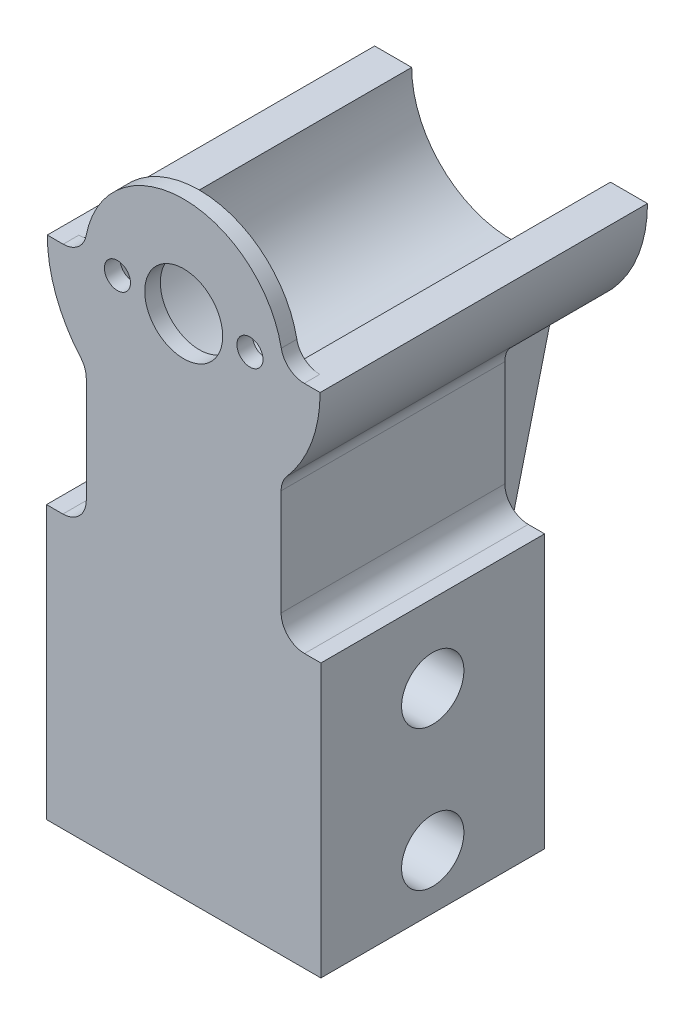
from build123d import *

# Parameters (mm, degrees)
SKETCH2_R               = 12.75
SKETCH2_R_2             = 5
SKETCH2_R_3             = 1.675
BOSS_EXTRUDE3_DEPTH     = 2
BOSS_EXTRUDE4_START     = -40
BOSS_EXTRUDE4_DEPTH     = 42
BOSS_EXTRUDE6_START     = -30
SKETCH7_W               = 35.2
SKETCH7_H               = 28.7
SKETCH7_R               = 9.725
BOSS_EXTRUDE6_DEPTH     = 35
BOSS_EXTRUDE7_START     = -26.7
BOSS_EXTRUDE7_DEPTH     = 26.7
CUT_EXTRUDE1_DEPTH      = 79.324708745
CUT_EXTRUDE1_DEPTH_BACK = 79.324708745
SKETCH6_R               = 4
RIB3_START              = -5
RIB3_DEPTH              = 10
FILLET2_R               = 3


with BuildPart() as part:
    # Sketch2 → Boss-Extrude3 (new body)
    # profile 1 of 2: a face of its own
    with BuildSketch(Plane.XY):
        Circle(SKETCH2_R)
        Circle(SKETCH2_R_2, mode=Mode.SUBTRACT)
        with Locations((8.5, 0)):
            Circle(SKETCH2_R_3, mode=Mode.SUBTRACT)
        with Locations((-8.5, 0)):
            Circle(SKETCH2_R_3, mode=Mode.SUBTRACT)
    # profile 2 of 2: a face of its own
    with BuildSketch(Plane.XY):
        with BuildLine():
            Line((12.5, -30), (12.5, -2.512468905))
            ThreePointArc((12.5, -2.512468905), (0, -12.75), (-12.5, -2.512468905))
            Line((-12.5, -2.512468905), (-12.5, -30))
            Line((-12.5, -30), (12.5, -30))
        make_face()
    extrude(amount=BOSS_EXTRUDE3_DEPTH)

    # Sketch3 → Boss-Extrude4 (add)
    with BuildSketch(Plane.XY.offset(BOSS_EXTRUDE4_START)):
        with BuildLine():
            Line((17.5, 0), (12.75, 0))
            ThreePointArc((12.75, 0), (0, -12.75), (-12.75, 0))
            Line((-12.75, 0), (-17.5, 0))
            ThreePointArc((-17.5, 0), (0, -17.5), (17.5, 0))
        make_face()
    extrude(amount=BOSS_EXTRUDE4_DEPTH)

    # Sketch7 → Boss-Extrude6 (add)
    with BuildSketch(Plane(origin=(0, 0, 0), x_dir=(1, 0, 0), z_dir=(0, 1, 0)).offset(BOSS_EXTRUDE6_START)):
        with Locations((0, 12.35)):
            Rectangle(SKETCH7_W, SKETCH7_H)
        with Locations(Location((0, 12.35, 0), (0, 0, 180))):
            Circle(SKETCH7_R, mode=Mode.SUBTRACT)
    extrude(amount=-BOSS_EXTRUDE6_DEPTH)

    # Sketch2<8> → Boss-Extrude7 (add)
    with BuildSketch(Plane.XY.offset(BOSS_EXTRUDE7_START)):
        with BuildLine():
            Line((12.5, -30), (12.5, -2.512468905))
            ThreePointArc((12.5, -2.512468905), (0, -12.75), (-12.5, -2.512468905))
            Line((-12.5, -2.512468905), (-12.5, -30))
            Line((-12.5, -30), (12.5, -30))
        make_face()
    extrude(amount=BOSS_EXTRUDE7_DEPTH)

    # Sketch6 → Cut-Extrude1 (cut, two sides: drawn at the far end of the back side and taken through both)
    with BuildSketch(Plane(origin=(0, 0, 0), x_dir=(0, 0, -1), z_dir=(1, 0, 0)).offset(-CUT_EXTRUDE1_DEPTH_BACK)):
        with Locations((12.35, -40)):
            Circle(SKETCH6_R)
        with Locations((12.35, -58)):
            Circle(SKETCH6_R)
    extrude(amount=CUT_EXTRUDE1_DEPTH + CUT_EXTRUDE1_DEPTH_BACK, mode=Mode.SUBTRACT)

    # Rib3: read off the stored shape, not the designer's step
    # Rib3 outline → Rib3 (add)
    with BuildSketch(Plane(origin=(0, -60, 0), x_dir=(0, -1, 0), z_dir=(-1, 0, 0)).offset(RIB3_START)):
        Polygon((5, -28.7), (5, -26.7), (-43.229490169, -26.7), (-43.229490169, -40), (-40.5, -40), align=None)
    extrude(amount=RIB3_DEPTH)

    # Fillet2
    fillet2_edges = [part.edges().sort_by_distance(p)[0] for p in [
        (12.5, -30, -12.35),
        (-12.5, -30, -12.35),
        (-12.75, 0, 1),
        (12.5, -12.247448714, -12.35),
        (12.75, 0, 1),
        (-12.5, -12.247448714, -12.35),
    ]]
    fillet(fillet2_edges, radius=FILLET2_R)


solid = part.part
